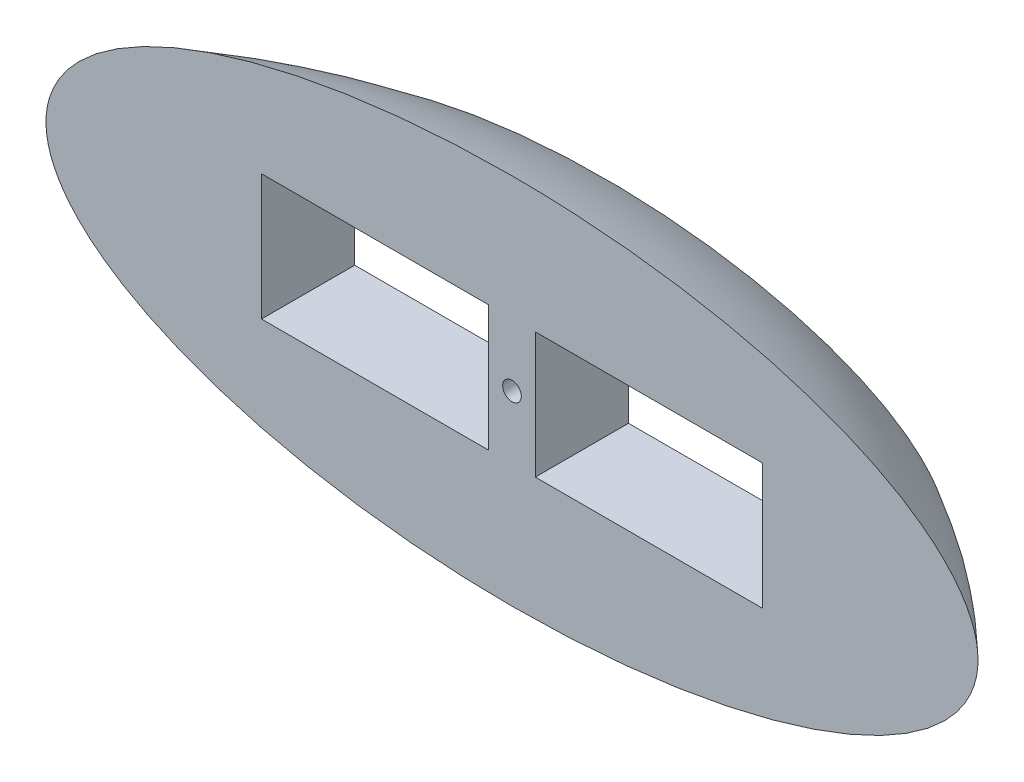
from build123d import *

# Parameters (mm, degrees)
BEAM_SCALE_X           = 1
BEAM_SCALE_Y           = 4
BEAM_SCALE_Z           = 1
LENGTH_SCALE_X         = 10
LENGTH_SCALE_Y         = 1
LENGTH_SCALE_Z         = 1
PAYLOAD_BAY_DEPTH      = 292.823782601
PAYLOAD_BAY_DEPTH_BACK = 63.5
SKETCH6_W              = 123.825
SKETCH6_H              = 68.58
MAST_HOLE_DEPTH        = 292.823782601
MAST_HOLE_DEPTH_BACK   = 101.6
SKETCH16_R             = 5.08
SKETCH15_2_W           = 508
SKETCH15_2_H           = 203.2
LAYER_2_DEPTH          = 50.8


with BuildPart() as part:
    # YZ Section_depthOnly → Depth (revolve)
    with BuildSketch(Plane(origin=(0, 0, 0), x_dir=(0, 0, -1), z_dir=(1, 0, 0))):
        with BuildLine():
            Line((0, 0), (0, -25.4))
            add(Edge.make_bspline(
                [(0, -25.4), (101.6, -14.816666667), (101.6, 0)],
                knots=[5.507991934, 5.507991934, 5.507991934, 6.283185307, 6.283185307, 6.283185307], degree=2, weights=[1, 0.9258201, 1]))
            Line((101.6, 0), (0, 0))
        make_face()
    revolve(axis=Axis((0, 0, 254), (0, 0, -1)))

    # Sketch13 → Height (revolve)
    with BuildSketch(Plane(origin=(0, 0, 0), x_dir=(0, 0, -1), z_dir=(1, 0, 0))):
        with BuildLine():
            Line((0, 0), (-50.8, 0))
            add(Edge.make_bspline(
                [(-50.8, 0), (-50.8, -23.988888889), (0, -25.4)],
                knots=[0, 0, 0, 1.511938821, 1.511938821, 1.511938821], degree=2, weights=[1, 0.727606875, 1]))
            Line((0, -25.4), (0, 0))
        make_face()
    revolve(axis=Axis((0, 0, 0), (0, 0, 1)))


with BuildPart() as part_1:
    # Beam: scaled about (0, 0, 0)
    add(part.part.scale((BEAM_SCALE_X, BEAM_SCALE_Y, BEAM_SCALE_Z), about=(0, 0, 0)))


with BuildPart() as part_2:
    # Length: scaled about (0, 0, 0)
    add(part_1.part.scale((LENGTH_SCALE_X, LENGTH_SCALE_Y, LENGTH_SCALE_Z), about=(0, 0, 0)))

    # Sketch6 → Payload Bay (cut, two sides: drawn at the far end of the back side and taken through both)
    with BuildSketch(Plane.XY.offset(-PAYLOAD_BAY_DEPTH_BACK)):
        with Locations((-74.6125, 0)):
            Rectangle(SKETCH6_W, SKETCH6_H)
        with Locations((74.6125, 0)):
            Rectangle(SKETCH6_W, SKETCH6_H)
    extrude(amount=PAYLOAD_BAY_DEPTH + PAYLOAD_BAY_DEPTH_BACK, mode=Mode.SUBTRACT)

    # Sketch16 → Mast Hole (cut, two sides: drawn at the far end of the back side and taken through both)
    with BuildSketch(Plane.XY.offset(-MAST_HOLE_DEPTH_BACK)):
        Circle(SKETCH16_R)
    extrude(amount=MAST_HOLE_DEPTH + MAST_HOLE_DEPTH_BACK, mode=Mode.SUBTRACT)


with BuildPart() as body_2:
    # Sketch15<2> → Layer 2 (new body)
    with BuildSketch(Plane.XY):
        Rectangle(SKETCH15_2_W, SKETCH15_2_H)
    extrude(amount=-LAYER_2_DEPTH)


with BuildPart() as part_3:
    add(part_2.part)

    # Layer 2 Body: intersect body 2
    add(body_2.part, mode=Mode.INTERSECT)


solid = part_3.part
